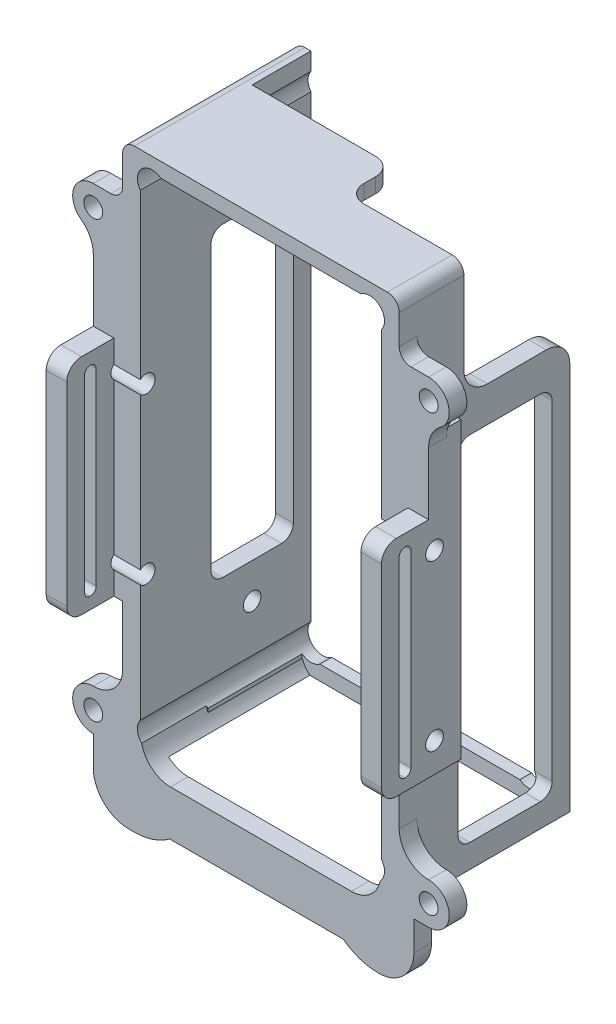
from build123d import *

# Parameters (mm, degrees)
SKETCH_1_R          = 1.6000000000000008
EXTRUDE_1_DEPTH     = 3
FILLET_1_R          = 5
FILLET_2_R          = 2
CUT_EXTRUDE_1_DEPTH = 22
EXTRUDE_2_DEPTH     = 8
FILLET_3_R          = 2.5
SKETCH_4_W          = 2.000000000000001
SKETCH_4_H          = 34
CUT_EXTRUDE_2_DEPTH = 78
FILLET_4_R          = 1
EXTRUDE_3_DEPTH     = 26
EXTRUDE_4_DEPTH     = 8
EXTRUDE_5_DEPTH     = 8
EXTRUDE_6_DEPTH     = 8
EXTRUDE_7_DEPTH     = 18
SKETCH_10_W         = 13.999999999999998
SKETCH_10_H         = 52
CUT_EXTRUDE_3_DEPTH = 10
SKETCH_11_W         = 16
SKETCH_11_H         = 60
CUT_EXTRUDE_4_DEPTH = 10
FILLET_5_R          = 2
EXTRUDE_8_DEPTH     = 26
CUT_EXTRUDE_5_DEPTH = 26
FILLET_6_R          = 4
FILLET_7_R          = 3
EXTRUDE_9_DEPTH     = 2.5
SKETCH_14_R         = 1.4999999999999998
SKETCH_14_R_2       = 1.5000000000000022
CUT_EXTRUDE_6_DEPTH = 105.99999999999999
SKETCH_17_R         = 1.5000000000000009
CUT_EXTRUDE_7_DEPTH = 5
EXTRUDE_10_DEPTH    = 3.5
SKETCH_19_R         = 0.8000000000000015
EXTRUDE_11_DEPTH    = 4
SKETCH_20_W         = 54.500000000000014
SKETCH_20_H         = 3
EXTRUDE_12_DEPTH    = 11
FILLET_8_R          = 6
CUT_EXTRUDE_8_DEPTH = 11
FILLET_START        = -26
FILLET_9_DEPTH      = 29
FILLET_9_2_DEPTH    = 3
SKETCH_22_W         = 29.470353622867343
SKETCH_22_H         = 2
CUT_EXTRUDE_9_DEPTH = 10
FILLET_10_R         = 10


with BuildPart() as part:
    # 草图1 → 凸台-拉伸1 (new body)
    with BuildSketch(Plane.XY):
        with BuildLine():
            Line((-23.5, 45.00000000000001), (23.5, 45.00000000000001))
            Line((23.5, 45.00000000000001), (23.499999999999996, 36.00000000000001))
            Line((23.499999999999996, 36.00000000000001), (28.5, 36))
            ThreePointArc((28.5, 36), (32, 32.5), (28.499999999999996, 28.999999999999996))
            Line((28.499999999999996, 28.999999999999996), (28.500000000000014, -23))
            Line((28.500000000000014, -23), (23.500000000000007, -23))
            Line((23.500000000000007, -23), (23.50000000000001, -38))
            Line((23.50000000000001, -38), (28.500000000000014, -38))
            ThreePointArc((28.500000000000014, -38), (32.00000000000001, -41.49999999999999), (28.500000000000014, -45))
            Line((28.500000000000014, -45), (23.50000000000001, -45))
            Line((23.50000000000001, -45), (-23.50000000000001, -45))
            Line((-23.50000000000001, -45), (-28.500000000000014, -45))
            ThreePointArc((-28.500000000000014, -45), (-32.00000000000001, -41.49999999999999), (-28.500000000000014, -38))
            Line((-28.500000000000014, -38), (-23.50000000000001, -38))
            Line((-23.50000000000001, -38), (-23.499999999999993, -23.000000000000007))
            Line((-23.499999999999993, -23.000000000000007), (-28.5, -23.000000000000007))
            Line((-28.5, -23.000000000000007), (-28.499999999999996, 28.99999999999999))
            ThreePointArc((-28.499999999999996, 28.99999999999999), (-32, 32.49999999999999), (-28.5, 35.99999999999999))
            Line((-28.5, 35.99999999999999), (-23.499999999999996, 36))
            Line((-23.499999999999996, 36), (-23.5, 45.00000000000001))
        make_face()
        with Locations((28.5, 32.5)):
            Circle(SKETCH_1_R, mode=Mode.SUBTRACT)
        with Locations((28.500000000000014, -41.49999999999999)):
            Circle(SKETCH_1_R, mode=Mode.SUBTRACT)
        with Locations(Location((-28.500000000000014, -41.49999999999999, 0), (0, 0, 180))):
            Circle(SKETCH_1_R, mode=Mode.SUBTRACT)
        with Locations(Location((-28.5, 32.49999999999999, 0), (0, 0, 180))):
            Circle(SKETCH_1_R, mode=Mode.SUBTRACT)
    extrude(amount=EXTRUDE_1_DEPTH)

    # 圆角1
    fillet_1_edges = [part.edges().sort_by_distance(p)[0] for p in [
        (28.499999999999996, 29, 1.5),
        (-28.499999999999996, 28.999999999999993, 1.5),
        (-23.50000000000001, -38, 1.5),
        (23.50000000000001, -38, 1.5),
    ]]
    fillet(fillet_1_edges, radius=FILLET_1_R - 0.0001)  # a hair under: the kernel refuses the full size

    # 圆角2
    fillet_2_edges = [part.edges().sort_by_distance(p)[0] for p in [
        (23.499999999999996, 36.00000000000001, 1.5),
        (-23.499999999999996, 36, 1.5),
        (-23.5, 45.00000000000001, 1.5),
        (23.5, 45.00000000000001, 1.5),
    ]]
    fillet(fillet_2_edges, radius=FILLET_2_R)

    # 草图2 → 切除-拉伸1 (cut)
    with BuildSketch(Plane.XY.offset(3)):
        with BuildLine():
            Line((-16.99999999999998, -42.49999999999999), (16.99999999999998, -42.49999999999994))
            ThreePointArc((16.99999999999998, -42.49999999999994), (20.26776695296638, -42.26776695296634), (20.500000000000007, -38.999999999999964))
            Line((20.500000000000007, -38.999999999999964), (20.500000000000007, 39.00000000000001))
            ThreePointArc((20.500000000000007, 39.00000000000001), (20.267766952966383, 42.26776695296637), (17.00000000000002, 42.500000000000014))
            Line((17.00000000000002, 42.500000000000014), (-17.00000000000002, 42.500000000000014))
            ThreePointArc((-17.00000000000002, 42.500000000000014), (-20.267766952966383, 42.26776695296637), (-20.500000000000007, 39.00000000000001))
            Line((-20.500000000000007, 39.00000000000001), (-20.500000000000007, -39.00000000000002))
            ThreePointArc((-20.500000000000007, -39.00000000000002), (-20.267766952966372, -42.2677669529664), (-16.99999999999998, -42.49999999999999))
        make_face()
    extrude(amount=-CUT_EXTRUDE_1_DEPTH, mode=Mode.SUBTRACT)

    # 草图3 → 凸台-拉伸2 (add)
    with BuildSketch(Plane.XY.offset(3)):
        Polygon((-28.5, -23.000000000000007), (-25, -23.000000000000007), (-25, 14.999999999999993), (-28.500000000000014, 14.999999999999993), align=None)
        Polygon((28.5, -23.000000000000007), (25, -23.000000000000007), (25, 14.999999999999993), (28.500000000000014, 14.999999999999993), align=None)
    extrude(amount=EXTRUDE_2_DEPTH)

    # 圆角3
    fillet_3_edges = [part.edges().sort_by_distance(p)[0] for p in [
        (-26.75, -23.000000000000007, 11),
        (-26.750000000000007, 14.999999999999993, 11),
        (26.750000000000007, 14.999999999999993, 11),
        (26.75, -23.000000000000007, 11),
    ]]
    fillet(fillet_3_edges, radius=FILLET_3_R)

    # 草图4 → 切除-拉伸2 (cut)
    with BuildSketch(Plane.ZY.offset(28.5)):
        with Locations((7.0000000000000036, -4.000000000000009)):
            Rectangle(SKETCH_4_W, SKETCH_4_H)
    extrude(amount=-CUT_EXTRUDE_2_DEPTH, mode=Mode.SUBTRACT)

    # 圆角4
    fillet_4_edges = [part.edges().sort_by_distance(p)[0] for p in [
        (-26.75, 12.999999999999995, 8.000000000000004),
        (-26.75, 12.999999999999995, 6.000000000000003),
        (-26.750000000000004, -21.000000000000007, 8.000000000000004),
        (-26.750000000000004, -21.000000000000007, 6.000000000000003),
        (26.750000000000007, -21.00000000000002, 6.000000000000003),
        (26.750000000000007, -21.00000000000002, 8.000000000000004),
        (26.750000000000004, 12.99999999999998, 6.000000000000003),
        (26.750000000000004, 12.99999999999998, 8.000000000000004),
    ]]
    fillet(fillet_4_edges, radius=FILLET_4_R - 0.0001)  # a hair under: the kernel refuses the full size

    # 草图5 → 凸台-拉伸3 (add)
    with BuildSketch(Plane(origin=(0, 0, 0), x_dir=(-1, 0, 0), z_dir=(0, 0, -1))):
        with BuildLine():
            Line((23.499999999999993, -23.000000000000007), (23.5, 43))
            ThreePointArc((23.5, 43), (22.914213562373092, 44.4142135623731), (21.5, 45.00000000000001))
            Line((21.5, 45.00000000000001), (20.50000000000001, 45.00000000000001))
            Line((20.50000000000001, 45.00000000000001), (20.500000000000007, 42))
            ThreePointArc((20.500000000000007, 42), (21.00000000000001, 40.50000000000001), (20.500000000000007, 39.00000000000001))
            Line((20.500000000000007, 39.00000000000001), (20.500000000000007, -39.00000000000002))
            ThreePointArc((20.500000000000007, -39.00000000000002), (21.000000000000004, -40.50000000000001), (20.50000000000002, -41.99999999999999))
            Line((20.50000000000002, -41.99999999999999), (20.500000000000007, -45))
            Line((20.500000000000007, -45), (23.500000000000007, -45))
            Line((23.500000000000007, -45), (23.499999999999993, -23.000000000000007))
        make_face()
    extrude(amount=EXTRUDE_3_DEPTH)

    # 草图6 → 凸台-拉伸4 (add)
    with BuildSketch(Plane(origin=(0, 0, 0), x_dir=(-1, 0, 0), z_dir=(0, 0, -1))):
        with BuildLine():
            Line((-17.000000000000025, 42.500000000000014), (17.00000000000002, 42.500000000000014))
            ThreePointArc((17.00000000000002, 42.500000000000014), (19.61803398874991, 42.736067977499786), (21.00000000000001, 40.5))
            Line((21.00000000000001, 40.5), (23.5, 40.49999999999995))
            Line((23.5, 40.49999999999995), (23.5, 43))
            ThreePointArc((23.5, 43), (22.914213562373092, 44.41421356237311), (21.499999999999982, 45.00000000000001))
            Line((21.499999999999982, 45.00000000000001), (-21.5, 45.00000000000001))
            ThreePointArc((-21.5, 45.00000000000001), (-22.9142135623731, 44.4142135623731), (-23.5, 43))
            Line((-23.5, 43), (-23.5, 42.500000000000014))
            Line((-23.5, 42.500000000000014), (-19.999999999999996, 42.500000000000014))
            ThreePointArc((-19.999999999999996, 42.500000000000014), (-18.50000000000001, 43.00000000000001), (-17.000000000000025, 42.500000000000014))
        make_face()
    extrude(amount=EXTRUDE_4_DEPTH)

    # 草图7 → 凸台-拉伸5 (add)
    with BuildSketch(Plane(origin=(0, 0, -8), x_dir=(-1, 0, 0), z_dir=(0, 0, -1))):
        with BuildLine():
            Line((21.5, 45.00000000000001), (-3.500000000000003, 45.00000000000001))
            Line((-3.500000000000003, 45.00000000000001), (-3.500000000000003, 42.500000000000014))
            Line((-3.500000000000003, 42.500000000000014), (17.00000000000002, 42.500000000000014))
            ThreePointArc((17.00000000000002, 42.500000000000014), (19.61803398874991, 42.73606797749978), (21.00000000000001, 40.5))
            Line((21.00000000000001, 40.5), (23.5, 40.49999999999999))
            Line((23.5, 40.49999999999999), (23.5, 43))
            ThreePointArc((23.5, 43), (22.914213562373096, 44.4142135623731), (21.5, 45.00000000000001))
        make_face()
    extrude(amount=EXTRUDE_5_DEPTH)

    # 草图8 → 凸台-拉伸6 (add)
    with BuildSketch(Plane(origin=(0, 0, 0), x_dir=(-1, 0, 0), z_dir=(0, 0, -1))):
        with BuildLine():
            Line((-20.500000000000014, -38.99999999999996), (-20.500000000000007, 39.00000000000001))
            ThreePointArc((-20.500000000000007, 39.00000000000001), (-20.974873734152926, 40.853553390593284), (-19.999999999999996, 42.500000000000014))
            Line((-19.999999999999996, 42.500000000000014), (-19.999999999999996, 45.00000000000001))
            Line((-19.999999999999996, 45.00000000000001), (-21.5, 45.00000000000001))
            ThreePointArc((-21.5, 45.00000000000001), (-22.914213562373096, 44.4142135623731), (-23.5, 43))
            Line((-23.5, 43), (-23.499999999999993, -45.00000000000001))
            Line((-23.499999999999993, -45.00000000000001), (-20.500000000000007, -45))
            Line((-20.500000000000007, -45), (-20.499999999999986, -41.99999999999999))
            ThreePointArc((-20.499999999999986, -41.99999999999999), (-21.00000000000001, -40.49999999999998), (-20.500000000000014, -38.99999999999996))
        make_face()
    extrude(amount=EXTRUDE_6_DEPTH)

    # 草图9 → 凸台-拉伸7 (add)
    with BuildSketch(Plane(origin=(0, 0, -8), x_dir=(-1, 0, 0), z_dir=(0, 0, -1))):
        with BuildLine():
            Line((-23.499999999999993, -45.00000000000001), (-23.500000000000007, 25.000000000000043))
            Line((-23.500000000000007, 25.000000000000043), (-20.50000000000001, 25.000000000000043))
            Line((-20.50000000000001, 25.000000000000043), (-20.500000000000014, -38.99999999999996))
            ThreePointArc((-20.500000000000014, -38.99999999999996), (-21.00000000000001, -40.49999999999998), (-20.499999999999986, -41.99999999999999))
            Line((-20.499999999999986, -41.99999999999999), (-20.500000000000007, -45))
            Line((-20.500000000000007, -45), (-23.499999999999993, -45.00000000000001))
        make_face()
    extrude(amount=EXTRUDE_7_DEPTH)

    # 草图10 → 切除-拉伸3 (cut)
    with BuildSketch(Plane.ZY.offset(23.499999999999964)):
        with Locations((-15.999999999999993, 1.0000000000000036)):
            Rectangle(SKETCH_10_W, SKETCH_10_H)
    extrude(amount=-CUT_EXTRUDE_3_DEPTH, mode=Mode.SUBTRACT)

    # 草图11 → 切除-拉伸4 (cut)
    with BuildSketch(Plane(origin=(23.5, 5.44e-15, 0), x_dir=(0, 0, -1), z_dir=(1, 2.1e-16, 0))):
        with Locations((15, -11.000000000000009)):
            Rectangle(SKETCH_11_W, SKETCH_11_H)
    extrude(amount=-CUT_EXTRUDE_4_DEPTH, mode=Mode.SUBTRACT)

    # 圆角5
    fillet_5_edges = [part.edges().sort_by_distance(p)[0] for p in [
        (-21.999999999999986, -24.999999999999968, -22.999999999999993),
        (-21.999999999999982, 27.00000000000003, -22.999999999999993),
        (-21.999999999999982, 27.00000000000003, -8.999999999999995),
        (-21.999999999999986, -24.999999999999968, -8.999999999999995),
        (22, 18.999999999999996, -6.999999999999999),
        (22.2247448713915, -41, -6.999999999999999),
        (22, 18.999999999999996, -23),
        (22.2247448713915, -41, -23),
    ]]
    fillet(fillet_5_edges, radius=FILLET_5_R)

    # 草图12 → 凸台-拉伸8 (add)
    with BuildSketch(Plane(origin=(0, 0, 0), x_dir=(-1, 0, 0), z_dir=(0, 0, -1))):
        with BuildLine():
            Line((-20.500000000000007, -45), (-20.499999999999986, -41.99999999999999))
            ThreePointArc((-20.499999999999986, -41.99999999999999), (-18.853553390593245, -42.97487373415287), (-16.99999999999998, -42.49999999999994))
            Line((-16.99999999999998, -42.49999999999994), (16.999999999999986, -42.499999999999986))
            ThreePointArc((16.999999999999986, -42.499999999999986), (18.853553390593277, -42.97487373415292), (20.500000000000018, -41.99999999999999))
            Line((20.500000000000018, -41.99999999999999), (20.500000000000007, -45))
            Line((20.500000000000007, -45), (-20.500000000000007, -45))
        make_face()
    extrude(amount=EXTRUDE_8_DEPTH)

    # 草图13 → 切除-拉伸5 (cut)
    with BuildSketch(Plane.XZ.offset(45)):
        Polygon((19.999999999999986, -23.999999999999993), (-20.000000000000014, -23.999999999999996), (-20.000000000000014, 2.2e-16), (19.999999999999986, 5.42e-15), align=None)
    extrude(amount=-CUT_EXTRUDE_5_DEPTH, mode=Mode.SUBTRACT)

    # 圆角6
    fillet_6_edges = [part.edges().sort_by_distance(p)[0] for p in [
        (22.000000000000007, 25.000000000000043, -8),
        (22.000000000000007, 25.000000000000043, -26),
    ]]
    fillet(fillet_6_edges, radius=FILLET_6_R)

    # 圆角7
    fillet_7_edges = [part.edges().sort_by_distance(p)[0] for p in [
        (3.500000000000003, 43.750000000000014, -16),
        (3.500000000000003, 43.750000000000014, -8),
    ]]
    fillet(fillet_7_edges, radius=FILLET_7_R)

    # 草图16 → 凸台-拉伸9 (add)
    with BuildSketch(Plane(origin=(0, 0, 0), x_dir=(-1, 0, 0), z_dir=(0, 0, -1))):
        Polygon((-28.500000000000014, -23), (-23.499999999999993, -23), (-23.500000000000004, 27.000000000000046), (-28.500000000000014, 27.000000000000046), align=None)
        Polygon((28.5, -23.000000000000007), (23.500000000000007, -23.000000000000007), (23.5, 27.000000000000043), (28.500000000000014, 27.000000000000043), align=None)
    extrude(amount=EXTRUDE_9_DEPTH)

    # 草图14 → 切除-拉伸6 (cut)
    with BuildSketch(Plane(origin=(28.500000000000007, 9.51e-15, 0), x_dir=(0, 0, -1), z_dir=(1, 2.7e-16, 0))):
        with Locations(Location((-1.9999999999999996, 9.999999999999984, 0), (0, 0, 90))):
            Circle(SKETCH_14_R)
        with Locations(Location((-1.9999999999999962, -18.00000000000001, 0), (0, 0, 90))):
            Circle(SKETCH_14_R_2)
    extrude(amount=-CUT_EXTRUDE_6_DEPTH, mode=Mode.SUBTRACT)

    # 草图17 → 切除-拉伸7 (cut)
    with BuildSketch(Plane.ZY.offset(23.499999999999964)):
        with Locations(Location((-15.999999999999993, -31, 0), (0, 0, 270))):
            Circle(SKETCH_17_R)
    extrude(amount=-CUT_EXTRUDE_7_DEPTH, mode=Mode.SUBTRACT)

    # 草图18 → 凸台-拉伸10 (add)
    with BuildSketch(Plane.XZ.offset(-42.500000000000014)):
        Polygon((-17.00000000000002, -4), (-2.082e-14, -4), (-2.038e-14, -9.000000000000002), (-17.00000000000002, -9.000000000000004), align=None)
    extrude(amount=EXTRUDE_10_DEPTH)

    # 草图19 → 凸台-拉伸11 (add)
    with BuildSketch(Plane(origin=(0, 0, 0), x_dir=(9e-17, 0, -1), z_dir=(1, 0, 9e-17))):
        with Locations(Location((6.499999999999999, 40.750000000000014, 0), (0, 0, 180))):
            Circle(SKETCH_19_R)
    extrude(amount=EXTRUDE_11_DEPTH)

    # 草图20 → 凸台-拉伸12 (add)
    with BuildSketch(Plane.XZ.offset(45)):
        with Locations((-1.2500000000000036, 1.5)):
            Rectangle(SKETCH_20_W, SKETCH_20_H)
    extrude(amount=EXTRUDE_12_DEPTH)

    # 圆角8
    fillet_8_edges = [part.edges().sort_by_distance(p)[0] for p in [
        (-28.500000000000014, -56, 1.5),
        (26.000000000000004, -56, 1.5),
    ]]
    fillet(fillet_8_edges, radius=FILLET_8_R)

    # 草图21 → 切除-拉伸8 (cut)
    with BuildSketch(Plane.XY.offset(3)):
        Polygon((-20.267766952966365, -42.26776695296638), (-20.267766952966365, -46.26776695296639), (20.267766952966323, -46.26776695296639), (20.267766952966365, -42.26776695296634), align=None)
    extrude(amount=-CUT_EXTRUDE_8_DEPTH, mode=Mode.SUBTRACT)

    # 圆角9: read off the stored shape, not the designer's step
    # 圆角9 outline → 圆角9 (add)
    with BuildSketch(Plane.XY.offset(FILLET_START)):
        with BuildLine():
            Line((20.267766953, -45), (20.267766953, -42.267766953))
            ThreePointArc((20.267766953, -42.267766953), (19.702826089, -43.760979585), (18.696014013, -45))
            Line((18.696014013, -45), (20.267766953, -45))
        make_face()
        with BuildLine():
            ThreePointArc((-18.696014013, -45), (-19.702826089, -43.760979585), (-20.267766953, -42.267766953))
            Line((-20.267766953, -42.267766953), (-20.267766953, -45))
            Line((-20.267766953, -45), (-18.696014013, -45))
        make_face()
    extrude(amount=FILLET_9_DEPTH)

    # Fillet 9 2 outline → Fillet 9 2 (add)
    with BuildSketch(Plane.XY):
        with BuildLine():
            Line((20.267766953, -46.267766953), (20.267766953, -45))
            Line((20.267766953, -45), (18.696014013, -45))
            ThreePointArc((18.696014013, -45), (17.149073226, -45.940087856), (15.368787467, -46.267766953))
            Line((15.368787467, -46.267766953), (20.267766953, -46.267766953))
        make_face()
        with BuildLine():
            ThreePointArc((-15.368787467, -46.267766953), (-17.149073226, -45.940087856), (-18.696014013, -45))
            Line((-18.696014013, -45), (-20.267766953, -45))
            Line((-20.267766953, -45), (-20.267766953, -46.267766953))
            Line((-20.267766953, -46.267766953), (-15.368787467, -46.267766953))
        make_face()
    extrude(amount=FILLET_9_2_DEPTH)

    # 草图22 → 切除-拉伸9 (cut)
    with BuildSketch(Plane.XY.offset(3)):
        with Locations((-0.7697480423883158, -54.99999999999999)):
            Rectangle(SKETCH_22_W, SKETCH_22_H)
    extrude(amount=-CUT_EXTRUDE_9_DEPTH, mode=Mode.SUBTRACT)

    # 圆角10
    # the kernel refuses this fillet: 10 mm, written as the material it takes off along each edge
    with BuildSketch(Plane(origin=(13.965428769045356, -55.99999999999999, 18.000000000001606), x_dir=(1.1369e-13, 1, 0), z_dir=(0, 0, -1))) as fillet_10_piece_1:
        with BuildLine():
            CenterArc((10.000000000000675, 5.999999999999506), FILLET_10_R, 179.9999999999935, 36.869897645847004)
            Line((6.7502e-13, 6.000000000000643), (0, 0))
            Line((0, 0), (2.0000000000003055, 0))
        make_face()
    extrude(amount=33.00000000000321, mode=Mode.SUBTRACT)
    with BuildSketch(Plane(origin=(-15.504924853821988, -55.99999999999999, 18.000000000001613), x_dir=(-1, -1.18e-15, 0), z_dir=(0, 0, -1))) as fillet_10_piece_2:
        with BuildLine():
            CenterArc((6.000000000000633, 10), FILLET_10_R, 233.13010235415305, 36.869897645847004)
            Line((2.2678e-13, 2.0000000000003055), (0, 0))
            Line((0, 0), (6.000000000000645, 0))
        make_face()
    extrude(amount=33.000000000003226, mode=Mode.SUBTRACT)


solid = part.part
